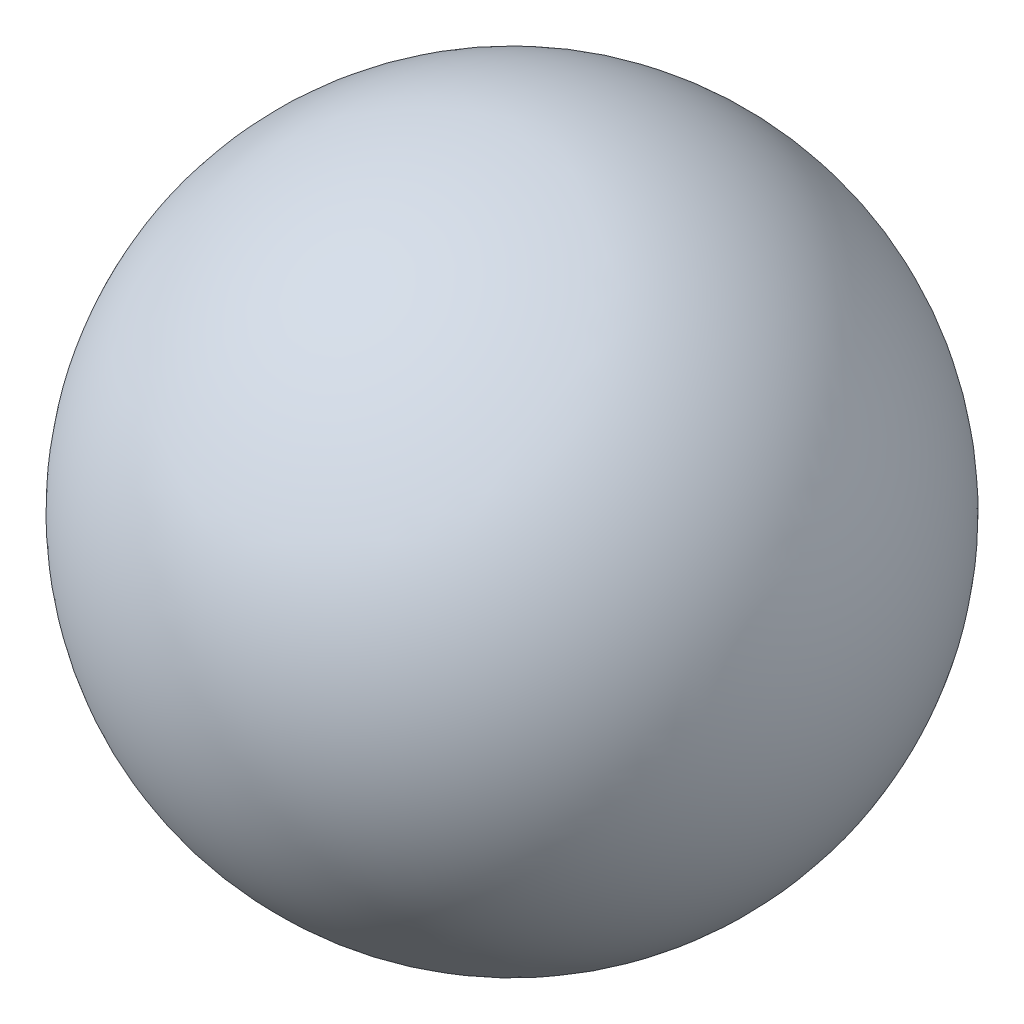
from build123d import *


with BuildPart() as part:
    # 草圖1 → 旋轉3 (revolve)
    with BuildSketch(Plane(origin=(0, 0, 0), x_dir=(1, 0, 0), z_dir=(0, 1, 0))):
        with BuildLine():
            Line((-10, 0), (10, 0))
            ThreePointArc((10, 0), (0, 10), (-10, 0))
        make_face()
    revolve(axis=Axis((-88.99, 0, 0), (1, 0, 0)))


solid = part.part
